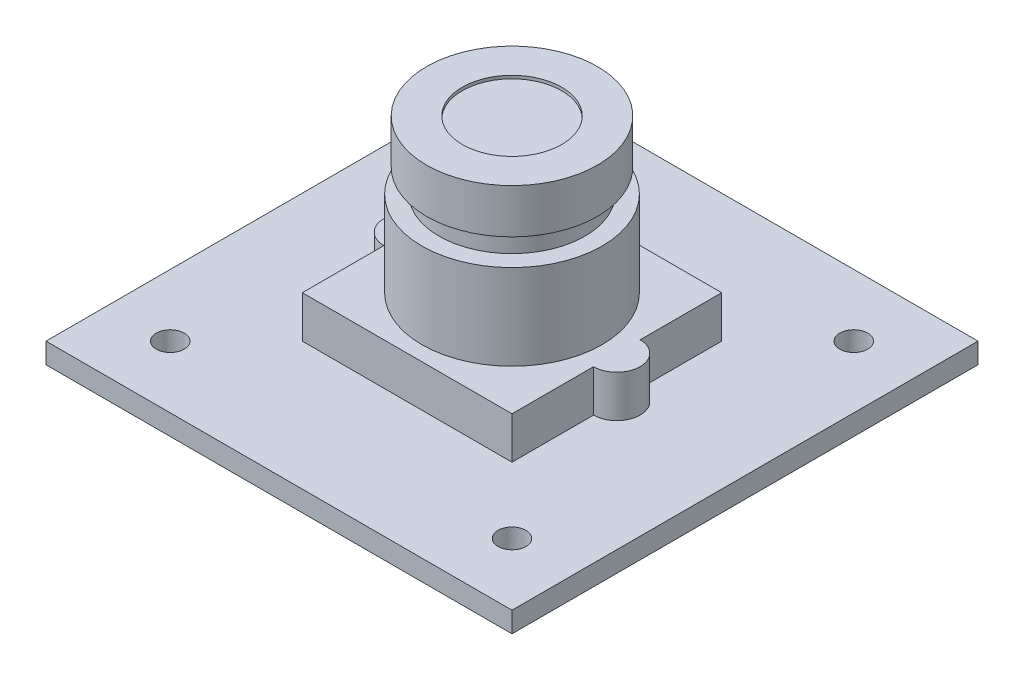
from build123d import *

# Parameters (mm, degrees)
SKETCH1_W           = 38.1
SKETCH1_H           = 38.1
SKETCH1_R           = 1.143
BOSS_EXTRUDE1_DEPTH = 1.6764
BOSS_EXTRUDE2_DEPTH = 3.429
SKETCH3_R           = 7.366
BOSS_EXTRUDE3_DEPTH = 6.985
SKETCH4_R           = 5.969
BOSS_EXTRUDE4_DEPTH = 1.905
SKETCH5_R           = 6.985
BOSS_EXTRUDE5_DEPTH = 3.6322
SKETCH6_R           = 4.064
CUT_EXTRUDE1_DEPTH  = 0.254
SKETCH7_W           = 10.033
SKETCH7_H           = 4.7244
SKETCH7_W_2         = 8.763
SKETCH7_H_2         = 3.4544
BOSS_EXTRUDE6_DEPTH = 6.604
CUT_EXTRUDE2_REACH  = 41.725
SKETCH9_W           = 3.175
SKETCH9_H           = 6.604


with BuildPart() as part:
    # Sketch1 → Boss-Extrude1 (new body)
    with BuildSketch(Plane(origin=(0, 0, 0), x_dir=(1, 0, 0), z_dir=(0, 1, 0))):
        Rectangle(SKETCH1_W, SKETCH1_H)
        with Locations((-13.97, 13.97)):
            Circle(SKETCH1_R, mode=Mode.SUBTRACT)
        with Locations((-13.97, -13.97)):
            Circle(SKETCH1_R, mode=Mode.SUBTRACT)
        with Locations((13.97, -13.97)):
            Circle(SKETCH1_R, mode=Mode.SUBTRACT)
        with Locations((13.97, 13.97)):
            Circle(SKETCH1_R, mode=Mode.SUBTRACT)
    extrude(amount=BOSS_EXTRUDE1_DEPTH)

    # Sketch2 → Boss-Extrude2 (add)
    with BuildSketch(Plane(origin=(0, 1.6764, 0), x_dir=(1, 0, 0), z_dir=(0, 1, 0))):
        with BuildLine():
            Line((-8.5725, -1.905), (-8.5725, -8.5725))
            Line((-8.5725, -8.5725), (8.5725, -8.5725))
            Line((8.5725, -8.5725), (8.5725, -1.905))
            ThreePointArc((8.5725, -1.905), (10.4775, 0), (8.5725, 1.905))
            Line((8.5725, 1.905), (8.5725, 8.5725))
            Line((8.5725, 8.5725), (-8.5725, 8.5725))
            Line((-8.5725, 8.5725), (-8.5725, 1.905))
            ThreePointArc((-8.5725, 1.905), (-10.4775, 0), (-8.5725, -1.905))
        make_face()
    extrude(amount=BOSS_EXTRUDE2_DEPTH)

    # Sketch3 → Boss-Extrude3 (add)
    with BuildSketch(Plane(origin=(0, 5.1054, 0), x_dir=(1, 0, 0), z_dir=(0, 1, 0))):
        Circle(SKETCH3_R)
    extrude(amount=BOSS_EXTRUDE3_DEPTH)

    # Sketch4 → Boss-Extrude4 (add)
    with BuildSketch(Plane(origin=(0, 12.0904, 0), x_dir=(1, 0, 0), z_dir=(0, 1, 0))):
        Circle(SKETCH4_R)
    extrude(amount=BOSS_EXTRUDE4_DEPTH)

    # Sketch5 → Boss-Extrude5 (add)
    with BuildSketch(Plane(origin=(0, 13.9954, 0), x_dir=(1, 0, 0), z_dir=(0, 1, 0))):
        Circle(SKETCH5_R)
    extrude(amount=BOSS_EXTRUDE5_DEPTH)

    # Sketch6 → Cut-Extrude1 (cut)
    with BuildSketch(Plane(origin=(0, 17.6276, 0), x_dir=(1, 0, 0), z_dir=(0, 1, 0))):
        Circle(SKETCH6_R)
    extrude(amount=-CUT_EXTRUDE1_DEPTH, mode=Mode.SUBTRACT)

    # Sketch7 → Boss-Extrude6 (add)
    with BuildSketch(Plane.XZ):
        with Locations((-6.2865, -13.3858)):
            Rectangle(SKETCH7_W, SKETCH7_H)
        with Locations((-6.2865, -13.3858)):
            Rectangle(SKETCH7_W_2, SKETCH7_H_2, mode=Mode.SUBTRACT)
    extrude(amount=BOSS_EXTRUDE6_DEPTH)

    # Sketch9 → Cut-Extrude2 (cut, up to next)
    with BuildSketch(Plane.XY.offset(-11.0236), mode=Mode.PRIVATE) as cut_extrude2_sk1:
        with Locations((-6.2865, -3.302)):
            Rectangle(SKETCH9_W, SKETCH9_H)
    cut_extrude2_tool1 = extrude(cut_extrude2_sk1.sketch, amount=-CUT_EXTRUDE2_REACH, mode=Mode.PRIVATE) & part.part
    add(cut_extrude2_tool1.solids().sort_by_distance((-6.2865, -3.302, -11.0236))[0], mode=Mode.SUBTRACT)


solid = part.part
